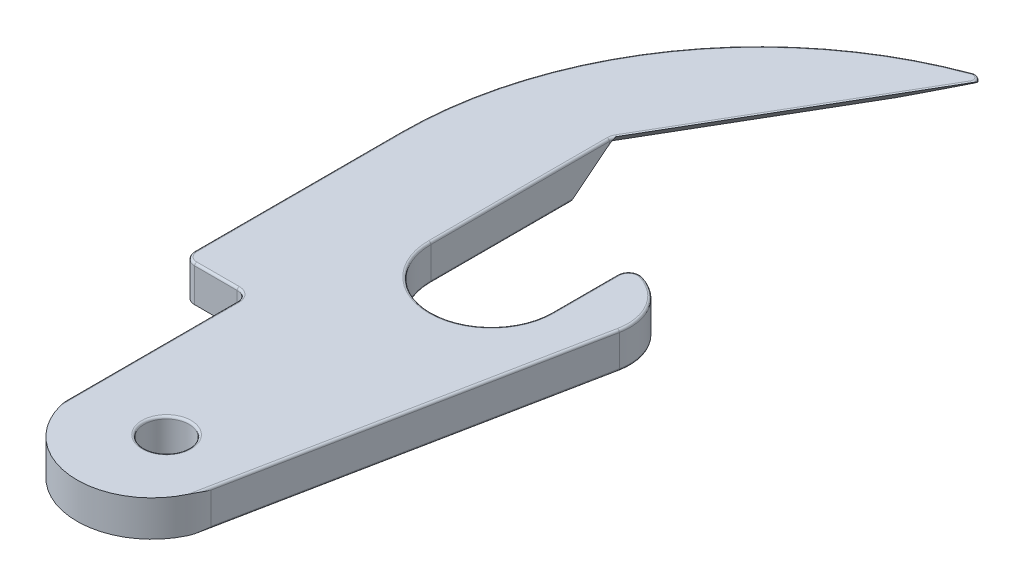
from build123d import *

# Parameters (mm, degrees)
BOSS_EXTRUDE1_DEPTH = 1.6
SKETCH2_R           = 1.0000000000000044
SKETCH2_W           = 2.9000000000000004
SKETCH2_H           = 11
CUT_EXTRUDE1_DEPTH  = 39.174860837991275
FILLET1_R           = 0.5
FILLET10_R          = 0.3
FILLET9_R           = 0.1
CUT_EXTRUDE2_DEPTH  = 15.000001
CUT_REVOLVE1_ANGLE  = 118.304837
FILLET6_R           = 0.1
FILLET14_DEPTH      = 3
CUT_EXTRUDE3_DEPTH  = 0.5
FILLET15_R          = 3.8


with BuildPart() as part:
    # Sketch1 → Boss-Extrude1 (new body)
    with BuildSketch(Plane(origin=(0, 0, 0), x_dir=(1, 0, 0), z_dir=(0, 1, 0))):
        with BuildLine():
            Line((11.249999999999995, 36), (4.949999999999998, 25.199999999999996))
            Line((4.949999999999998, 25.199999999999996), (4.95, 17.099999999999998))
            ThreePointArc((4.95, 17.099999999999998), (7.6499999999999995, 14.399999999999999), (10.350000000000003, 17.099999999999998))
            Line((10.350000000000003, 17.099999999999998), (10.35, 20.588517047756877))
            ThreePointArc((10.35, 20.588517047756877), (12.089132450024001, 19.766073814149554), (12.556853597053188, 17.9))
            Line((12.556853597053188, 17.9), (9, 0))
            Line((9, 0), (0, 0))
            Line((0, 0), (0, 20.699999999999996))
            ThreePointArc((0, 20.699999999999996), (3.1152199182423743, 30.195426530704133), (11.249999999999995, 36))
        make_face()
    extrude(amount=BOSS_EXTRUDE1_DEPTH)

    # Sketch2 → Cut-Extrude1 (cut, through all)
    with BuildSketch(Plane(origin=(0, 1.6, 0), x_dir=(1, 0, 0), z_dir=(0, 1, 0))):
        with Locations(Location((6.5, 3.75, 0), (0, 0, 270))):
            Circle(SKETCH2_R)
        with Locations((1.4500000000000002, 5.5)):
            Rectangle(SKETCH2_W, SKETCH2_H)
    extrude(amount=-CUT_EXTRUDE1_DEPTH, mode=Mode.SUBTRACT)

    # Fillet1
    fillet1_edges = [part.edges().sort_by_distance(p)[0] for p in [
        (4.949999999999998, 0.8, -25.199999999999996),
        (10.35, 0.8, -20.588517047756877),
        (0, 0.8, -11),
        (2.9, 0.8, -11),
    ]]
    fillet(fillet1_edges, radius=FILLET1_R)

    # Fillet10
    fillet10_edges = [part.edges().sort_by_distance(p)[0] for p in [
        (11.249999999999995, 0.8, -36),
    ]]
    fillet(fillet10_edges, radius=FILLET10_R)

    # Fillet9
    fillet9_edges = [part.edges().sort_by_distance(p)[0] for p in [
        (10.778426798526594, 1.6, -8.95),
        (12.27700878864588, 1.6, -19.500040671486303),
        (7.650000000000002, 1.6, -14.4),
        (4.949999999999999, 1.6, -21.082412714662503),
        (2.9, 1.6, -5.25),
        (0, 1.6, -16.099999999999998),
        (1.45, 1.6, -11),
        (10.350000000000001, 1.6, -18.55778401544086),
        (7.931660533666676, 1.6, -30.311418057714306),
        (10.551192847666401, 1.6, -20.416459893750357),
        (0.1464466094067261, 1.6, -11.146446609406727),
        (2.7535533905932734, 1.6, -10.853553390593273),
        (4.967327893272973, 1.6, -25.195315418932243),
        (2.8791430216859144, 1.6, -29.865702507166827),
        (10.8159085390423, 1.6, -35.6500508828696),
    ]]
    fillet(fillet9_edges, radius=FILLET9_R)

    # Sketch4 → Cut-Extrude2 (cut)
    with BuildSketch(Plane(origin=(12.57617593241207, 1.6, -38.27344445556355), x_dir=(-0.8637789008984336, 0, -0.503871025524086), z_dir=(0.503871025524086, 0, -0.8637789008984336))):
        Polygon((0, 0), (2.0000000000000004, -1.6), (-0.3356716848088581, -1.6), (-0.3356716848088581, 0), align=None)
    extrude(amount=-CUT_EXTRUDE2_DEPTH, mode=Mode.SUBTRACT)

    # Cut-Revolve1: read off the stored shape, not the designer's step
    # Cut-Revolve1 outline → Cut-Revolve1 (revolve, cut)
    with BuildSketch(Plane(origin=(5.01811055, 0, -25.316760942), x_dir=(-0.8637788973054713, 0, -0.5038710316834497), z_dir=(0.5038710316834497, 0, -0.8637788973054713))):
        Polygon((0, 0), (2, 0), (0.032626635, 1.573898692), (0, 1.573898692), align=None)
    revolve(axis=Axis((5.01811055, 0, -25.316760942), (0, 0.9999999999999999, 0)), revolution_arc=CUT_REVOLVE1_ANGLE, mode=Mode.SUBTRACT)

    # Fillet6
    fillet6_edges = [part.edges().sort_by_distance(p)[0] for p in [
        (12.27700878864588, 0, -19.500040671486303),
        (10.778426798526594, 0, -8.95),
        (6.5, 0, -4.750000000000004),
        (6.5, 1.6, -4.750000000000004),
        (10.350000000000001, 0, -18.55778401544086),
        (10.551192847666401, 0, -20.416459893750357),
        (4.949999999999999, 0, -20.20896051992093),
        (7.650000000000002, 0, -14.4),
    ]]
    fillet(fillet6_edges, radius=FILLET6_R)

    # Fillet14: read off the stored shape, not the designer's step
    # Fillet14 outline → Fillet14 (cut)
    with BuildSketch(Plane(origin=(0, 0, 0), x_dir=(1, 0, 0), z_dir=(0, 1, 0))):
        with BuildLine():
            ThreePointArc((9.535946874, 2.697172876), (8.375627771, 0.760646462), (6.250094443, 0))
            Line((6.250094443, 0), (9, 0))
            Line((9, 0), (9.535946874, 2.697172876))
        make_face()
        with BuildLine():
            ThreePointArc((6.250094443, 0), (3.881219944, 0.981219945), (2.9, 3.350094443))
            Line((2.9, 3.350094443), (2.9, 0))
            Line((2.9, 0), (6.250094443, 0))
        make_face()
    extrude(amount=FILLET14_DEPTH, mode=Mode.SUBTRACT)

    # Sketch6 → Cut-Extrude3 (cut)
    with BuildSketch(Plane.XZ):
        with BuildLine():
            Line((0.75, -23.199999999999992), (0.75, -12.69999999999999))
            ThreePointArc((0.75, -12.69999999999999), (2.6254751789798503, -17.949999999999992), (0.75, -23.199999999999992))
        make_face()
    extrude(amount=-CUT_EXTRUDE3_DEPTH, mode=Mode.SUBTRACT)

    # Fillet15
    # the kernel refuses this fillet: 3.8 mm, written as the material it adds along each edge
    with BuildSketch(Plane(origin=(-5.660400180851672, 0.5, -17.949999999999992), x_dir=(0.31070324909360797, 0, 0.9505069652573175), z_dir=(-0.9505069652573175, 0, 0.31070324909360797))) as fillet15_piece_1_section:
        with BuildLine():
            CenterArc((6.401730991689845, -3.8), FILLET15_R, 60.27567085289292, 29.724329147107078)
            Line((6.401730991689845, 0), (6.401730991689845, 0.07599999999999994))
            Line((6.401730991689845, 0.07599999999999994), (8.285875359831522, 0.07599999999999994))
            Line((8.285875359831522, 0.07599999999999994), (8.361875359831522, 0))
            ThreePointArc((8.361875359831522, 0), (8.361875359831522, -0.24999999999999997), (8.323558247194356, -0.434))
            Line((8.323558247194356, -0.434), (8.285875359831522, -0.49999999999999994))
        make_face()
    fillet15_piece_1 = revolve(axis=Axis((-5.660400180851672, 0.5, -17.949999999999992), (0, 1, 0)), revolution_arc=143.79676670450274, mode=Mode.PRIVATE)
    fillet15_piece_1 = split(fillet15_piece_1, bisect_by=Plane(origin=(0.75, 0.5, -17.949999999999992), z_dir=(1, 0, 0)), keep=Keep.TOP, mode=Mode.PRIVATE)
    add(fillet15_piece_1)


solid = part.part
